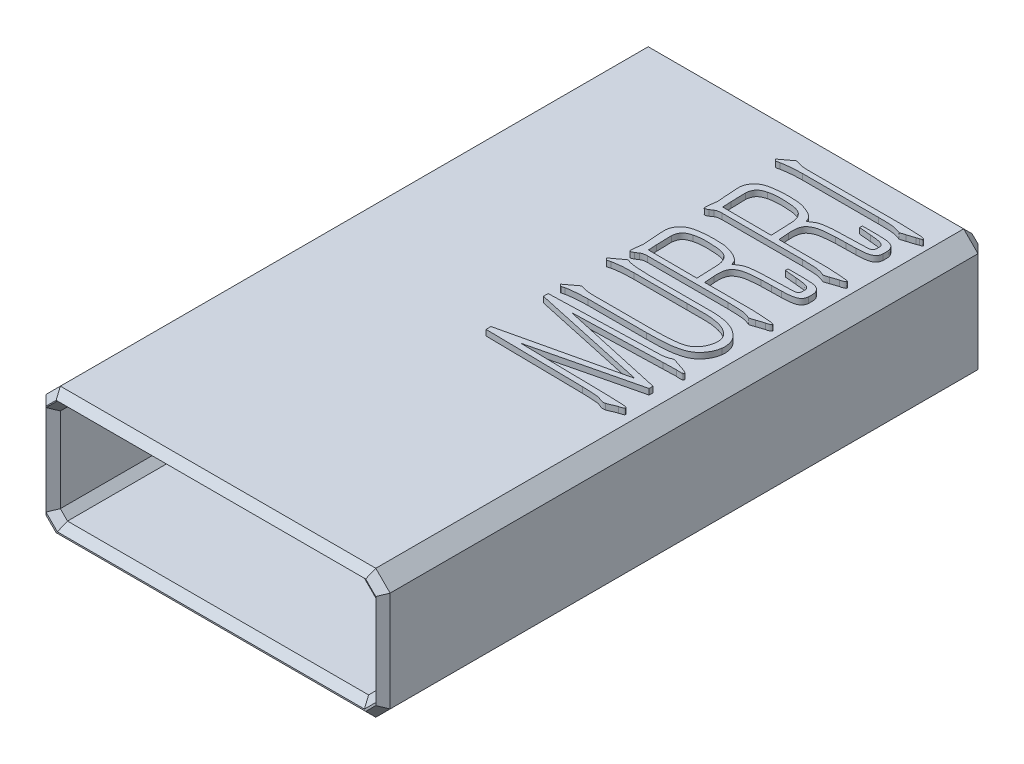
from build123d import *

# Parameters (mm, degrees)
SKETCH1_W           = 12
SKETCH1_H           = 4.5
SKETCH1_W_2         = 11
SKETCH1_H_2         = 3.45
BOSS_EXTRUDE1_DEPTH = 21.25
SKETCH2_W           = 12
SKETCH2_H           = 4.5
BOSS_EXTRUDE2_DEPTH = 1
CHAMFER1_SIZE       = 0.25
CHAMFER2_SIZE       = 0.5
CHAMFER3_SIZE       = 0.5
CHAMFER4_SIZE       = 0.25
CHAMFER5_SIZE       = 0.25
BOSS_EXTRUDE3_DEPTH = 0.2


with BuildPart() as part:
    # Sketch1 → Boss-Extrude1 (new body)
    with BuildSketch(Plane.XY):
        with Locations((6, 2.25)):
            Rectangle(SKETCH1_W, SKETCH1_H)
        with Locations((6, 2.275)):
            Rectangle(SKETCH1_W_2, SKETCH1_H_2, mode=Mode.SUBTRACT)
    extrude(amount=BOSS_EXTRUDE1_DEPTH)

    # Sketch2 → Boss-Extrude2 (add)
    with BuildSketch(Plane.XY):
        with Locations((6, 2.25)):
            Rectangle(SKETCH2_W, SKETCH2_H)
    extrude(amount=BOSS_EXTRUDE2_DEPTH)

    # Chamfer1
    chamfer1_edges = [part.edges().sort_by_distance(p)[0] for p in [
        (0.5, 4, 11.125),
        (0.5, 0.55, 11.125),
        (11.5, 0.55, 11.125),
        (11.5, 4, 11.125),
    ]]
    chamfer(chamfer1_edges, length=CHAMFER1_SIZE)

    # Chamfer2
    chamfer2_edges = [part.edges().sort_by_distance(p)[0] for p in [
        (0, 4.5, 10.625),
        (12, 4.5, 10.625),
        (12, 0, 10.625),
        (0, 0, 10.625),
    ]]
    chamfer(chamfer2_edges, length=CHAMFER2_SIZE)

    # Chamfer3
    chamfer3_edges = [part.edges().sort_by_distance(p)[0] for p in [
        (12, 2.25, 0),
        (0, 2.25, 0),
        (6, 4.5, 0),
        (6, 0, 0),
        (0.25, 4.25, 0),
        (0.25, 0.25, 0),
        (11.75, 4.25, 0),
        (11.75, 0.25, 0),
    ]]
    chamfer(chamfer3_edges, length=CHAMFER3_SIZE)

    # Chamfer4
    chamfer4_edges = [part.edges().sort_by_distance(p)[0] for p in [
        (12, 2.25, 21.25),
        (6, 0, 21.25),
        (0, 2.25, 21.25),
        (6, 4.5, 21.25),
        (0.25, 4.25, 21.25),
        (0.25, 0.25, 21.25),
        (11.75, 4.25, 21.25),
        (11.75, 0.25, 21.25),
    ]]
    chamfer(chamfer4_edges, length=CHAMFER4_SIZE)

    # Chamfer5
    chamfer5_edges = [part.edges().sort_by_distance(p)[0] for p in [
        (6, 0.55, 21.25),
        (11.5, 2.275, 21.25),
        (6, 4, 21.25),
        (0.5, 2.275, 21.25),
        (11.375, 0.675, 21.25),
        (11.375, 3.875, 21.25),
        (0.625, 0.675, 21.25),
        (0.625, 3.875, 21.25),
    ]]
    chamfer(chamfer5_edges, length=CHAMFER5_SIZE - 0.0001)  # a hair under: the kernel refuses the full size

    # Sketch3 → Boss-Extrude3 (add)
    # profile 1 of 5: a face of its own
    with BuildSketch(Plane(origin=(0, 4.5, 0), x_dir=(1, 0, 0), z_dir=(0, 1, 0))):
        with BuildLine():
            Line((6.408374174, -10.063404118), (6.408374174, -9.898264548))
            Line((6.408374174, -9.898264548), (9.78148306, -9.79811539))
            Line((9.78148306, -9.79811539), (10.097911784, -9.790657474))
            add(Edge.make_bspline(
                [(10.097911784, -9.790657474), (10.133074665, -9.790299434), (10.192804257, -9.789691246), (10.272977707, -9.784779271), (10.33947594, -9.773977392), (10.402801642, -9.759287431), (10.463109407, -9.741710792), (10.514814565, -9.721231324), (10.552809134, -9.702736276), (10.582656795, -9.691760941), (10.61143664, -9.696895999), (10.648360747, -9.704872606), (10.701254758, -9.72488823), (10.742458237, -9.738960021), (10.765927978, -9.746975394)],
                knots=[0, 0, 0, 0, 1.833619664, 3.114686552, 4.183267866, 5.342211314, 6.502189863, 7.458137416, 8.229013798, 8.72761631, 9.062984896, 9.7278169, 10.705751284, 12, 12, 12, 12], degree=3))
            Line((10.765927978, -9.746975394), (11.010973791, -9.826881638))
            add(Edge.make_bspline(
                [(11.010973791, -9.826881638), (11.033378665, -9.835692324), (11.072972529, -9.851262556), (11.123574784, -9.872127151), (11.157962578, -9.88753908), (11.179775082, -9.901761515), (11.192919786, -9.916215805), (11.196470791, -9.93422715), (11.186013789, -9.949130752), (11.175137677, -9.95330761), (11.168655444, -9.955797044)],
                knots=[0, 0, 0, 0, 2.256952659, 3.988483765, 5.135235217, 5.781778538, 6.421425199, 6.92532559, 7.359487195, 8, 8, 8, 8], degree=3))
            add(Edge.make_bspline(
                [(11.168655444, -9.955797044), (11.159938474, -9.960289551), (11.137756512, -9.971721577), (11.090940907, -9.971811455), (11.028339065, -9.971719626), (10.980449442, -9.966307319), (10.953441296, -9.96325496)],
                knots=[0, 0, 0, 0, 0.533370556, 1.357261302, 2.50958371, 4, 4, 4, 4], degree=3))
            Line((10.953441296, -9.96325496), (10.50063925, -9.977105375))
            Line((10.50063925, -9.977105375), (7.386426593, -10.063404118))
            Line((7.386426593, -10.063404118), (11.039740038, -10.868859051))
            Line((11.039740038, -10.868859051), (11.032282122, -11.006297789))
            Line((11.032282122, -11.006297789), (7.429043256, -11.875677717))
            Line((7.429043256, -11.875677717), (10.535797997, -11.933210212))
            Line((10.535797997, -11.933210212), (10.982207543, -11.948126044))
            add(Edge.make_bspline(
                [(10.982207543, -11.948126044), (11.014615534, -11.948300784), (11.072596653, -11.94861341), (11.139150645, -11.958944289), (11.180471279, -11.969138633), (11.199097458, -11.976975429), (11.212895663, -11.986061596), (11.212512042, -11.994405023), (11.212337524, -11.998200623)],
                knots=[0, 0, 0, 0, 2.35867652, 4.21990684, 4.917432392, 5.427710553, 5.739653463, 6, 6, 6, 6], degree=3))
            add(Edge.make_bspline(
                [(11.212337524, -11.998200623), (11.2119862, -12.003251133), (11.211234306, -12.014060109), (11.200234689, -12.03288735), (11.167622475, -12.048722113), (11.13010383, -12.060202716), (11.094613311, -12.072386801), (11.07198274, -12.07811701), (11.057340596, -12.083300012), (11.04969668, -12.084203895), (11.047197954, -12.084499366)],
                knots=[0, 0, 0, 0, 0.609790462, 1.30505856, 2.525401483, 4.85740158, 6.125560505, 7.067287064, 7.695104769, 8, 8, 8, 8], degree=3))
            Line((11.047197954, -12.084499366), (10.723311315, -12.214480189))
            add(Edge.make_bspline(
                [(10.723311315, -12.214480189), (10.707061903, -12.217988168), (10.675147538, -12.224877951), (10.62454796, -12.223606244), (10.571116097, -12.209933126), (10.515702861, -12.190024818), (10.465110492, -12.16849508), (10.427473298, -12.154527663), (10.398712181, -12.146015214), (10.369954157, -12.14287589), (10.3320716, -12.137944772), (10.287895675, -12.135775409), (10.243834038, -12.132960821), (10.20626375, -12.129192146), (10.177761409, -12.127722389), (10.157949119, -12.125160143), (10.140906449, -12.12359422), (10.120646868, -12.122670096), (10.091498544, -12.121914404), (10.053558865, -12.118998315), (10.006616174, -12.119006516), (9.951267769, -12.115817746), (9.886942602, -12.115723549), (9.841142655, -12.11412224), (9.816641807, -12.113265614)],
                knots=[0, 0, 0, 0, 1.187969647, 2.333210464, 3.586158238, 5.12312342, 6.550003327, 7.523861941, 7.999186015, 8.693658805, 9.589978601, 10.737478277, 11.859592069, 12.753380394, 13.442237408, 13.903039052, 14.184071854, 14.668167729, 15.355613632, 16.272992588, 17.392796313, 18.716837295, 20.243660171, 22, 22, 22, 22], degree=3))
            Line((9.816641807, -12.113265614), (6.408374174, -12.063191035))
            Line((6.408374174, -12.063191035), (6.408374174, -11.890593549))
            Line((6.408374174, -11.890593549), (10.478265502, -10.948765294))
            Line((10.478265502, -10.948765294), (6.408374174, -10.063404118))
        make_face()
    # profile 2 of 5: a face of its own
    with BuildSketch(Plane(origin=(0, 4.5, 0), x_dir=(1, 0, 0), z_dir=(0, 1, 0))):
        with BuildLine():
            add(Edge.make_bspline(
                [(6.761027062, -9.084286283), (6.78524265, -9.090428969), (6.829507949, -9.101657596), (6.894259681, -9.122051655), (6.96504597, -9.135778033), (7.033808884, -9.148556549), (7.104301703, -9.156673924), (7.174002455, -9.16057444), (7.257502062, -9.162304204), (7.317884155, -9.162840219), (7.350202429, -9.16312711)],
                knots=[0, 0, 0, 0, 1.003716487, 1.834760708, 2.724721785, 3.897654695, 4.644570232, 5.573815479, 6.701434605, 8, 8, 8, 8], degree=3))
            Line((7.350202429, -9.16312711), (9.313765182, -9.16312711))
            add(Edge.make_bspline(
                [(9.313765182, -9.16312711), (9.389415412, -9.162829469), (9.53365461, -9.162261971), (9.739748528, -9.155017912), (9.925193473, -9.14206118), (10.090358091, -9.126196551), (10.235139128, -9.103013848), (10.358267597, -9.068931465), (10.46191891, -9.028281231), (10.542824647, -8.972646814), (10.60777678, -8.911071292), (10.663803981, -8.845866663), (10.710687178, -8.775218878), (10.749045276, -8.700771446), (10.777923794, -8.624619818), (10.801047093, -8.550510436), (10.814399414, -8.478191415), (10.816191655, -8.430879815), (10.817067974, -8.407746756)],
                knots=[0, 0, 0, 0, 1.905203819, 3.632574198, 5.192565944, 6.586287381, 7.811156405, 8.878821117, 9.800770685, 10.599565557, 11.333646137, 12.050580277, 12.760055205, 13.464096933, 14.15506361, 14.808726733, 15.417525614, 16, 16, 16, 16], degree=3))
            add(Edge.make_bspline(
                [(10.817067974, -8.407746756), (10.816698932, -8.373506349), (10.815985385, -8.307302151), (10.791838218, -8.212769672), (10.74985983, -8.128179719), (10.688427226, -8.0580151), (10.619890121, -7.996713544), (10.545955517, -7.945861164), (10.469624575, -7.903033841), (10.363432363, -7.862120452), (10.228542319, -7.824900399), (10.068187184, -7.795968993), (9.915424707, -7.778689192), (9.803533459, -7.774654947), (9.726436853, -7.774929845), (9.675296424, -7.774874293), (9.612437004, -7.774894557), (9.53750265, -7.774887522), (9.450138509, -7.7748899), (9.350699622, -7.774889123), (9.239186022, -7.774889364), (9.161055473, -7.774889328), (9.119859365, -7.774889309)],
                knots=[0, 0, 0, 0, 1.015663207, 1.963795819, 2.875740241, 3.798333249, 4.718745757, 5.606813955, 6.462685027, 7.316139764, 8.985121632, 10.618098866, 12.159395575, 13.555042318, 13.945965981, 14.453110192, 15.076474951, 15.816060259, 16.682431619, 17.675589033, 18.77440149, 20, 20, 20, 20], degree=3))
            Line((9.119859365, -7.774889309), (7.271361602, -7.774889309))
            add(Edge.make_bspline(
                [(7.271361602, -7.774889309), (7.215954216, -7.775309884), (7.113988779, -7.776083863), (6.970076488, -7.781333451), (6.839517585, -7.79064076), (6.7363933, -7.804543375), (6.659091475, -7.815982623), (6.609863472, -7.822964999), (6.570508487, -7.831372869), (6.547219061, -7.837336933), (6.53728958, -7.83987972)],
                knots=[0, 0, 0, 0, 1.800454758, 3.313351646, 4.679077347, 6.051806317, 6.693209159, 7.218773997, 7.666923167, 8, 8, 8, 8], degree=3))
            Line((6.53728958, -7.83987972), (6.42222459, -7.868645968))
            Line((6.42222459, -7.868645968), (6.350841679, -7.803655556))
            Line((6.350841679, -7.803655556), (6.782335393, -7.487226833))
            add(Edge.make_bspline(
                [(6.782335393, -7.487226833), (6.806421777, -7.495908305), (6.850056067, -7.511635442), (6.916435264, -7.53288961), (6.99095733, -7.546403345), (7.081963986, -7.561639679), (7.190524268, -7.572064776), (7.267787942, -7.573028942), (7.307585766, -7.573525576)],
                knots=[0, 0, 0, 0, 0.860918451, 1.559618272, 2.339304497, 3.403130484, 4.662375828, 6, 6, 6, 6], degree=3))
            Line((7.307585766, -7.573525576), (7.645322821, -7.588441408))
            Line((7.645322821, -7.588441408), (9.356381845, -7.588441408))
            add(Edge.make_bspline(
                [(9.356381845, -7.588441408), (9.400774233, -7.588445696), (9.485297339, -7.588453861), (9.604623614, -7.588399544), (9.710101043, -7.588568887), (9.833723441, -7.587871539), (9.98470675, -7.592962025), (10.167374509, -7.612177821), (10.352151321, -7.643568084), (10.501232063, -7.690697191), (10.615763176, -7.738662344), (10.699427536, -7.783217881), (10.778930952, -7.839032418), (10.857639972, -7.898542263), (10.926485533, -7.967592874), (10.987523789, -8.039625309), (11.030333345, -8.119853697), (11.062687328, -8.201422273), (11.082102597, -8.283477822), (11.094004608, -8.362206626), (11.098405161, -8.437397549), (11.092624538, -8.485553208), (11.089814618, -8.508961331)],
                knots=[0, 0, 0, 0, 1.18432064, 2.254946499, 3.18345388, 3.998266481, 5.553134704, 7.210506707, 8.896047553, 10.544186214, 11.367765206, 12.207106871, 13.066424334, 13.957235019, 14.834898921, 15.663530758, 16.465070008, 17.248026882, 17.999450096, 18.708271688, 19.372100047, 20, 20, 20, 20], degree=3))
            add(Edge.make_bspline(
                [(11.089814618, -8.508961331), (11.084487198, -8.545066176), (11.073691482, -8.618230612), (11.03696347, -8.7261244), (10.983996684, -8.833301537), (10.915742586, -8.938004499), (10.834127098, -9.036300623), (10.736592584, -9.118736928), (10.627960648, -9.187329724), (10.506122246, -9.237171099), (10.375831952, -9.275933853), (10.237594491, -9.306614204), (10.091434808, -9.330406106), (9.884809334, -9.348698855), (9.61970186, -9.361135412), (9.406115711, -9.363369066), (9.29884935, -9.364490843)],
                knots=[0, 0, 0, 0, 0.695552955, 1.409498913, 2.164499868, 2.973121369, 3.790871823, 4.593903182, 5.400959929, 6.23333487, 7.097677464, 7.994104003, 8.934841278, 9.922489009, 11.952209119, 14, 14, 14, 14], degree=3))
            Line((9.29884935, -9.364490843), (7.25644577, -9.364490843))
            add(Edge.make_bspline(
                [(7.25644577, -9.364490843), (7.202093112, -9.364621659), (7.098992991, -9.364869801), (6.951926298, -9.374162049), (6.818088011, -9.386308916), (6.714667907, -9.397100041), (6.639968389, -9.408113002), (6.593523449, -9.413470091), (6.555561296, -9.421183967), (6.53336353, -9.426917747), (6.523439165, -9.429481254)],
                knots=[0, 0, 0, 0, 1.769193403, 3.355936188, 4.795300052, 6.144931018, 6.740140329, 7.253592783, 7.666289955, 8, 8, 8, 8], degree=3))
            Line((6.523439165, -9.429481254), (6.408374174, -9.458247502))
            Line((6.408374174, -9.458247502), (6.335925847, -9.400715007))
            Line((6.335925847, -9.400715007), (6.761027062, -9.084286283))
        make_face()
    # profile 3 of 5: a face of its own
    with BuildSketch(Plane(origin=(0, 4.5, 0), x_dir=(1, 0, 0), z_dir=(0, 1, 0))):
        with BuildLine():
            add(Edge.make_bspline(
                [(8.730982314, -5.812391972), (8.7618576, -5.791057438), (8.81785257, -5.752365435), (8.898588868, -5.697162216), (8.984798071, -5.653470741), (9.090282458, -5.625938304), (9.217618293, -5.604312682), (9.365693859, -5.588451328), (9.52948088, -5.57588994), (9.643306801, -5.575171739), (9.701576817, -5.574804075)],
                knots=[0, 0, 0, 0, 0.881232765, 1.598190978, 2.295533752, 3.137383339, 4.144986829, 5.328248715, 6.632271209, 8, 8, 8, 8], degree=3))
            Line((9.701576817, -5.574804075), (10.370658427, -5.553495744))
            add(Edge.make_bspline(
                [(10.370658427, -5.553495744), (10.407915068, -5.552813163), (10.479612753, -5.551499585), (10.581177182, -5.54921458), (10.664906214, -5.53813839), (10.726112515, -5.524165825), (10.757534431, -5.492920279), (10.771888454, -5.4571172), (10.779095059, -5.408908757), (10.780219422, -5.372404034), (10.78084381, -5.352132011)],
                knots=[0, 0, 0, 0, 1.650878855, 3.176995805, 4.477566197, 5.427151683, 5.849543733, 6.384248205, 7.102730973, 8, 8, 8, 8], degree=3))
            add(Edge.make_bspline(
                [(10.78084381, -5.352132011), (10.781816944, -5.331785023), (10.783637579, -5.293717905), (10.765466941, -5.238318213), (10.724488862, -5.192751072), (10.661378053, -5.162415594), (10.584168205, -5.13803349), (10.490516191, -5.125199209), (10.380055664, -5.112145033), (10.299660186, -5.104748126), (10.255593437, -5.100693698)],
                knots=[0, 0, 0, 0, 0.741989737, 1.388186353, 2.079962278, 2.924457633, 3.920621767, 5.041832983, 6.378555544, 8, 8, 8, 8], degree=3))
            Line((10.255593437, -5.100693698), (9.845408055, -5.064469535))
            Line((9.845408055, -5.064469535), (9.845408055, -4.970712876))
            Line((9.845408055, -4.970712876), (10.349350096, -4.970712876))
            add(Edge.make_bspline(
                [(10.349350096, -4.970712876), (10.396946775, -4.97112381), (10.484715751, -4.971881578), (10.604816112, -4.977101911), (10.70243695, -4.984578963), (10.779503383, -4.997222334), (10.842190286, -5.014525245), (10.894060989, -5.039107609), (10.939628867, -5.069089876), (10.975083987, -5.106890678), (11.004653118, -5.147556558), (11.025762926, -5.19212661), (11.041633224, -5.238890296), (11.047659997, -5.302304416), (11.052124954, -5.373785791), (11.048715567, -5.428840301), (11.047197954, -5.453346586)],
                knots=[0, 0, 0, 0, 1.955797874, 3.606520016, 4.939685233, 5.976159067, 6.81209678, 7.602055893, 8.326624086, 9.038739689, 9.719039995, 10.384783355, 11.058635172, 11.735640267, 12.992070879, 14, 14, 14, 14], degree=3))
            add(Edge.make_bspline(
                [(11.047197954, -5.453346586), (11.045751456, -5.470522022), (11.042990261, -5.503307921), (11.028184455, -5.548668172), (11.009257764, -5.589021829), (10.983105364, -5.624135604), (10.948796215, -5.653586222), (10.906224766, -5.677881341), (10.855713043, -5.699027038), (10.795468811, -5.717392641), (10.722109366, -5.732624779), (10.632530558, -5.741827524), (10.52564726, -5.75086823), (10.448457402, -5.7534623), (10.406882591, -5.754859477)],
                knots=[0, 0, 0, 0, 0.785514098, 1.499454538, 2.167605402, 2.81714562, 3.484704239, 4.219933844, 5.049370252, 5.984178009, 7.095655963, 8.469322192, 10.098360771, 12, 12, 12, 12], degree=3))
            Line((10.406882591, -5.754859477), (10.06168762, -5.762317393))
            Line((10.06168762, -5.762317393), (9.709034733, -5.769775309))
            add(Edge.make_bspline(
                [(9.709034733, -5.769775309), (9.662852403, -5.772424551), (9.564373736, -5.778073763), (9.415872996, -5.790563993), (9.271984948, -5.804587323), (9.145841008, -5.829605231), (9.038993429, -5.866772937), (8.947981016, -5.915835886), (8.87265888, -5.976365036), (8.820517733, -6.052206342), (8.791406179, -6.140830591), (8.775495159, -6.241825948), (8.769552922, -6.357150038), (8.772897958, -6.438509522), (8.774664394, -6.481473583)],
                knots=[0, 0, 0, 0, 1.186979477, 2.53110138, 3.824333442, 4.894950986, 5.823084238, 6.716241149, 7.537709362, 8.27836356, 9.042203288, 9.911181308, 10.896943164, 12, 12, 12, 12], degree=3))
            Line((8.774664394, -6.481473583), (8.803430641, -6.83412647))
            Line((8.803430641, -6.83412647), (10.50063925, -6.83412647))
            add(Edge.make_bspline(
                [(10.50063925, -6.83412647), (10.556401316, -6.837247746), (10.657993401, -6.842934351), (10.794683754, -6.851594558), (10.900526407, -6.858171041), (10.997140292, -6.86333025), (11.089638982, -6.870006803), (11.167798198, -6.879684902), (11.218840854, -6.89097385), (11.240561893, -6.895787126), (11.257981194, -6.903046704), (11.25576653, -6.910304957), (11.254954187, -6.912967297)],
                knots=[0, 0, 0, 0, 2.178808862, 3.96953971, 5.343703216, 6.315136572, 7.746501362, 8.949576488, 9.416965186, 9.732908192, 9.902030233, 10, 10, 10, 10], degree=3))
            add(Edge.make_bspline(
                [(11.254954187, -6.912967297), (11.254444306, -6.916236076), (11.253136816, -6.92461823), (11.242001427, -6.939332218), (11.215884354, -6.957241237), (11.17502501, -6.975713531), (11.128655289, -6.993888964), (11.096325566, -6.997643709), (11.082356701, -6.99926604)],
                knots=[0, 0, 0, 0, 0.292342883, 0.749657129, 1.586799747, 3.104202277, 4.748798175, 6, 6, 6, 6], degree=3))
            Line((11.082356701, -6.99926604), (10.823460473, -7.085564783))
            add(Edge.make_bspline(
                [(10.823460473, -7.085564783), (10.800014109, -7.093658289), (10.758851673, -7.107867249), (10.705652272, -7.127155004), (10.669125668, -7.136747264), (10.640008307, -7.142041111), (10.610822348, -7.129143793), (10.571409679, -7.11259081), (10.517920083, -7.091388349), (10.453415528, -7.074501794), (10.387411812, -7.05906766), (10.331482588, -7.049410305), (10.27974335, -7.045729699), (10.221938489, -7.040845871), (10.143368695, -7.038501074), (10.05174126, -7.035640595), (9.962618215, -7.03217323), (9.891189314, -7.031131167), (9.845430349, -7.027794095), (9.823390802, -7.027976447), (9.816641807, -7.028032288)],
                knots=[0, 0, 0, 0, 1.301983991, 2.285763148, 2.958964452, 3.29633742, 3.803082126, 4.571146853, 5.567543572, 6.806010732, 8.066831942, 9.123403438, 9.777784829, 10.786469319, 12.16609629, 13.899429871, 15.595526634, 16.844179072, 17.646062189, 18, 18, 18, 18], degree=3))
            Line((9.816641807, -7.028032288), (7.005007458, -7.028032288))
            add(Edge.make_bspline(
                [(7.005007458, -7.028032288), (6.983283634, -7.028523079), (6.941736208, -7.029461731), (6.882676521, -7.039926147), (6.8286521, -7.053100777), (6.797348761, -7.070001247), (6.782335393, -7.078106867)],
                knots=[0, 0, 0, 0, 1.127954724, 2.157245254, 3.116197974, 4, 4, 4, 4], degree=3))
            Line((6.782335393, -7.078106867), (6.674728319, -7.150555194))
            add(Edge.make_bspline(
                [(6.674728319, -7.150555194), (6.661723894, -7.157832204), (6.638325859, -7.170925266), (6.605282905, -7.186167234), (6.5783292, -7.191085888), (6.55546861, -7.19303058), (6.538612748, -7.176608033), (6.536893738, -7.148645832), (6.536134467, -7.110635141), (6.541582727, -7.081297826), (6.544747496, -7.064256451)],
                knots=[0, 0, 0, 0, 1.376189476, 2.476090326, 3.310291879, 3.9328338, 4.465478062, 5.267620607, 6.412823299, 8, 8, 8, 8], degree=3))
            Line((6.544747496, -7.064256451), (6.559663328, -6.912967297))
            Line((6.559663328, -6.912967297), (6.58097166, -6.761678143))
            Line((6.58097166, -6.761678143), (6.559663328, -6.481473583))
            add(Edge.make_bspline(
                [(6.559663328, -6.481473583), (6.555886805, -6.426085795), (6.548965075, -6.324569329), (6.542603239, -6.185575226), (6.534695275, -6.07452349), (6.528769445, -5.986476868), (6.530512418, -5.912529799), (6.540861616, -5.843464062), (6.562637173, -5.77613921), (6.593809889, -5.71119035), (6.632658481, -5.649565837), (6.680034751, -5.594463716), (6.732626412, -5.544289309), (6.793731856, -5.501261603), (6.864364006, -5.462660611), (6.948242851, -5.433434274), (7.043629, -5.405799198), (7.152008912, -5.387153338), (7.271053035, -5.371150377), (7.39972176, -5.359438905), (7.53765387, -5.353325048), (7.632531975, -5.352538401), (7.681546985, -5.352132011)],
                knots=[0, 0, 0, 0, 1.679844652, 3.078871672, 4.209725109, 5.049028505, 5.747860701, 6.443960972, 7.15426632, 7.880090953, 8.619393692, 9.351397016, 10.073632976, 10.81316998, 11.606497123, 12.500757424, 13.49418339, 14.609147992, 15.823466198, 17.129115867, 18.516871591, 20, 20, 20, 20], degree=3))
            add(Edge.make_bspline(
                [(7.681546985, -5.352132011), (7.728431669, -5.352517923), (7.81621372, -5.353240466), (7.938219947, -5.35899021), (8.041144721, -5.370163598), (8.150507596, -5.391357556), (8.268042428, -5.425428702), (8.393309645, -5.4757702), (8.502662643, -5.529431417), (8.579609019, -5.58043245), (8.628277285, -5.621986548), (8.657164348, -5.649295486), (8.676760133, -5.67708019), (8.684736429, -5.696121215), (8.688365651, -5.704784898)],
                knots=[0, 0, 0, 0, 1.521520026, 2.848737329, 3.962410036, 4.87785905, 6.46098997, 7.92489015, 9.254707097, 10.408681267, 10.907477065, 11.331258808, 11.695722187, 12, 12, 12, 12], degree=3))
            Line((8.688365651, -5.704784898), (8.730982314, -5.812391972))
        make_face()
        with BuildLine():
            Line((8.537076497, -6.84051897), (8.508310249, -6.128820696))
            add(Edge.make_bspline(
                [(8.508310249, -6.128820696), (8.506650336, -6.100364134), (8.503503849, -6.046422645), (8.491818747, -5.970464851), (8.47530652, -5.903810172), (8.445929453, -5.82992003), (8.398689027, -5.752191381), (8.335157852, -5.691246953), (8.276430684, -5.653826533), (8.223996729, -5.630880258), (8.16448835, -5.609077136), (8.093958733, -5.592507497), (8.010226495, -5.57677192), (7.908277158, -5.567356054), (7.786782343, -5.559651435), (7.651381556, -5.557435236), (7.513769047, -5.557033654), (7.385749146, -5.565882611), (7.272262397, -5.579491753), (7.202712914, -5.595891362), (7.170147027, -5.603570323)],
                knots=[0, 0, 0, 0, 0.918172889, 1.740463719, 2.473302386, 3.12576875, 4.297696032, 5.374318763, 5.929962264, 6.534276509, 7.214846156, 7.969870388, 8.86558466, 9.958868387, 11.266057701, 12.788632169, 14.32230717, 15.698757848, 16.92246516, 18, 18, 18, 18], degree=3))
            add(Edge.make_bspline(
                [(7.170147027, -5.603570323), (7.139992523, -5.61192929), (7.083443496, -5.62760494), (7.008573857, -5.662689787), (6.94576626, -5.699585707), (6.899451872, -5.746796666), (6.86406291, -5.799632474), (6.838989241, -5.861060397), (6.819205116, -5.930301427), (6.813881208, -5.980230331), (6.811101641, -6.006297789)],
                knots=[0, 0, 0, 0, 1.275631098, 2.392203014, 3.370219373, 4.231894316, 5.068789048, 5.952648395, 6.93109503, 8, 8, 8, 8], degree=3))
            add(Edge.make_bspline(
                [(6.811101641, -6.006297789), (6.811046509, -6.014821934), (6.810910945, -6.035782196), (6.812434746, -6.072703212), (6.813357507, -6.121360025), (6.81411923, -6.181394043), (6.816742711, -6.252755658), (6.81841237, -6.335526311), (6.822042842, -6.429614369), (6.823948563, -6.496387518), (6.824952056, -6.531548162)],
                knots=[0, 0, 0, 0, 0.389305479, 0.957274318, 1.687402304, 2.612145096, 3.699440328, 4.948883328, 6.393377747, 8, 8, 8, 8], degree=3))
            Line((6.824952056, -6.531548162), (6.839867888, -6.83412647))
            Line((6.839867888, -6.83412647), (8.537076497, -6.84051897))
        make_face(mode=Mode.SUBTRACT)
    # profile 4 of 5: a face of its own
    with BuildSketch(Plane(origin=(0, 4.5, 0), x_dir=(1, 0, 0), z_dir=(0, 1, 0))):
        with BuildLine():
            add(Edge.make_bspline(
                [(8.730982314, -3.221298855), (8.7618576, -3.199964321), (8.81785257, -3.161272318), (8.898588868, -3.106069099), (8.984798071, -3.062377624), (9.090282458, -3.034845187), (9.217618293, -3.013219565), (9.365693859, -2.99735821), (9.52948088, -2.984796823), (9.643306801, -2.984078621), (9.701576817, -2.983710958)],
                knots=[0, 0, 0, 0, 0.881232765, 1.598190978, 2.295533752, 3.137383339, 4.144986829, 5.328248715, 6.632271209, 8, 8, 8, 8], degree=3))
            Line((9.701576817, -2.983710958), (10.370658427, -2.962402626))
            add(Edge.make_bspline(
                [(10.370658427, -2.962402626), (10.407915068, -2.961720045), (10.479612753, -2.960406468), (10.581177182, -2.958121463), (10.664906214, -2.947045273), (10.726112515, -2.933072708), (10.757534431, -2.901827162), (10.771888454, -2.866024083), (10.779095059, -2.81781564), (10.780219422, -2.781310916), (10.78084381, -2.761038893)],
                knots=[0, 0, 0, 0, 1.650878855, 3.176995805, 4.477566197, 5.427151683, 5.849543733, 6.384248205, 7.102730973, 8, 8, 8, 8], degree=3))
            add(Edge.make_bspline(
                [(10.78084381, -2.761038893), (10.781816944, -2.740691906), (10.783637579, -2.702624788), (10.765466941, -2.647225096), (10.724488862, -2.601657955), (10.661378053, -2.571322477), (10.584168205, -2.546940373), (10.490516191, -2.534106092), (10.380055664, -2.521051915), (10.299660186, -2.513655008), (10.255593437, -2.509600581)],
                knots=[0, 0, 0, 0, 0.741989737, 1.388186353, 2.079962278, 2.924457633, 3.920621767, 5.041832983, 6.378555544, 8, 8, 8, 8], degree=3))
            Line((10.255593437, -2.509600581), (9.845408055, -2.473376417))
            Line((9.845408055, -2.473376417), (9.845408055, -2.379619758))
            Line((9.845408055, -2.379619758), (10.349350096, -2.379619758))
            add(Edge.make_bspline(
                [(10.349350096, -2.379619758), (10.396946775, -2.380030692), (10.484715751, -2.380788461), (10.604816112, -2.386008794), (10.70243695, -2.393485846), (10.779503383, -2.406129217), (10.842190286, -2.423432127), (10.894060989, -2.448014491), (10.939628867, -2.477996759), (10.975083987, -2.515797561), (11.004653118, -2.556463441), (11.025762926, -2.601033492), (11.041633224, -2.647797179), (11.047659997, -2.711211298), (11.052124954, -2.782692674), (11.048715567, -2.837747184), (11.047197954, -2.862253468)],
                knots=[0, 0, 0, 0, 1.955797874, 3.606520016, 4.939685233, 5.976159067, 6.81209678, 7.602055893, 8.326624086, 9.038739689, 9.719039995, 10.384783355, 11.058635172, 11.735640267, 12.992070879, 14, 14, 14, 14], degree=3))
            add(Edge.make_bspline(
                [(11.047197954, -2.862253468), (11.045751456, -2.879428905), (11.042990261, -2.912214804), (11.028184455, -2.957575055), (11.009257764, -2.997928711), (10.983105364, -3.033042486), (10.948796215, -3.062493105), (10.906224766, -3.086788224), (10.855713043, -3.107933921), (10.795468811, -3.126299524), (10.722109366, -3.141531661), (10.632530558, -3.150734407), (10.52564726, -3.159775113), (10.448457402, -3.162369182), (10.406882591, -3.16376636)],
                knots=[0, 0, 0, 0, 0.785514098, 1.499454538, 2.167605402, 2.81714562, 3.484704239, 4.219933844, 5.049370252, 5.984178009, 7.095655963, 8.469322192, 10.098360771, 12, 12, 12, 12], degree=3))
            Line((10.406882591, -3.16376636), (10.06168762, -3.171224276))
            Line((10.06168762, -3.171224276), (9.709034733, -3.178682192))
            add(Edge.make_bspline(
                [(9.709034733, -3.178682192), (9.662852403, -3.181331433), (9.564373736, -3.186980645), (9.415872996, -3.199470875), (9.271984948, -3.213494205), (9.145841008, -3.238512114), (9.038993429, -3.27567982), (8.947981016, -3.324742769), (8.87265888, -3.385271919), (8.820517733, -3.461113225), (8.791406179, -3.549737474), (8.775495159, -3.65073283), (8.769552922, -3.766056921), (8.772897958, -3.847416404), (8.774664394, -3.890380466)],
                knots=[0, 0, 0, 0, 1.186979477, 2.53110138, 3.824333442, 4.894950986, 5.823084238, 6.716241149, 7.537709362, 8.27836356, 9.042203288, 9.911181308, 10.896943164, 12, 12, 12, 12], degree=3))
            Line((8.774664394, -3.890380466), (8.803430641, -4.243033353))
            Line((8.803430641, -4.243033353), (10.50063925, -4.243033353))
            add(Edge.make_bspline(
                [(10.50063925, -4.243033353), (10.556401316, -4.246154628), (10.657993401, -4.251841234), (10.794683754, -4.260501441), (10.900526407, -4.267077923), (10.997140292, -4.272237133), (11.089638982, -4.278913686), (11.167798198, -4.288591784), (11.218840854, -4.299880732), (11.240561893, -4.304694009), (11.257981194, -4.311953586), (11.25576653, -4.319211839), (11.254954187, -4.32187418)],
                knots=[0, 0, 0, 0, 2.178808862, 3.96953971, 5.343703216, 6.315136572, 7.746501362, 8.949576488, 9.416965186, 9.732908192, 9.902030233, 10, 10, 10, 10], degree=3))
            add(Edge.make_bspline(
                [(11.254954187, -4.32187418), (11.254444306, -4.325142958), (11.253136816, -4.333525112), (11.242001427, -4.3482391), (11.215884354, -4.366148119), (11.17502501, -4.384620413), (11.128655289, -4.402795846), (11.096325566, -4.406550591), (11.082356701, -4.408172923)],
                knots=[0, 0, 0, 0, 0.292342883, 0.749657129, 1.586799747, 3.104202277, 4.748798175, 6, 6, 6, 6], degree=3))
            Line((11.082356701, -4.408172923), (10.823460473, -4.494471665))
            add(Edge.make_bspline(
                [(10.823460473, -4.494471665), (10.800014109, -4.502565172), (10.758851673, -4.516774132), (10.705652272, -4.536061886), (10.669125668, -4.545654147), (10.640008307, -4.550947994), (10.610822348, -4.538050676), (10.571409679, -4.521497692), (10.517920083, -4.500295232), (10.453415528, -4.483408677), (10.387411812, -4.467974543), (10.331482588, -4.458317188), (10.27974335, -4.454636581), (10.221938489, -4.449752753), (10.143368695, -4.447407957), (10.05174126, -4.444547478), (9.962618215, -4.441080113), (9.891189314, -4.44003805), (9.845430349, -4.436700978), (9.823390802, -4.43688333), (9.816641807, -4.43693917)],
                knots=[0, 0, 0, 0, 1.301983991, 2.285763148, 2.958964452, 3.29633742, 3.803082126, 4.571146853, 5.567543572, 6.806010732, 8.066831942, 9.123403438, 9.777784829, 10.786469319, 12.16609629, 13.899429871, 15.595526634, 16.844179072, 17.646062189, 18, 18, 18, 18], degree=3))
            Line((9.816641807, -4.43693917), (7.005007458, -4.43693917))
            add(Edge.make_bspline(
                [(7.005007458, -4.43693917), (6.983283634, -4.437429962), (6.941736208, -4.438368614), (6.882676521, -4.448833029), (6.8286521, -4.46200766), (6.797348761, -4.478908129), (6.782335393, -4.487013749)],
                knots=[0, 0, 0, 0, 1.127954724, 2.157245254, 3.116197974, 4, 4, 4, 4], degree=3))
            Line((6.782335393, -4.487013749), (6.674728319, -4.559462077))
            add(Edge.make_bspline(
                [(6.674728319, -4.559462077), (6.661723894, -4.566739087), (6.638325859, -4.579832149), (6.605282905, -4.595074116), (6.5783292, -4.59999277), (6.55546861, -4.601937462), (6.538612748, -4.585514916), (6.536893738, -4.557552715), (6.536134467, -4.519542023), (6.541582727, -4.490204709), (6.544747496, -4.473163334)],
                knots=[0, 0, 0, 0, 1.376189476, 2.476090326, 3.310291879, 3.9328338, 4.465478062, 5.267620607, 6.412823299, 8, 8, 8, 8], degree=3))
            Line((6.544747496, -4.473163334), (6.559663328, -4.32187418))
            Line((6.559663328, -4.32187418), (6.58097166, -4.170585026))
            Line((6.58097166, -4.170585026), (6.559663328, -3.890380466))
            add(Edge.make_bspline(
                [(6.559663328, -3.890380466), (6.555886805, -3.834992677), (6.548965075, -3.733476211), (6.542603239, -3.594482109), (6.534695275, -3.483430373), (6.528769445, -3.39538375), (6.530512418, -3.321436682), (6.540861616, -3.252370944), (6.562637173, -3.185046092), (6.593809889, -3.120097233), (6.632658481, -3.058472719), (6.680034751, -3.003370599), (6.732626412, -2.953196192), (6.793731856, -2.910168486), (6.864364006, -2.871567494), (6.948242851, -2.842341157), (7.043629, -2.814706081), (7.152008912, -2.79606022), (7.271053035, -2.78005726), (7.39972176, -2.768345788), (7.53765387, -2.762231931), (7.632531975, -2.761445283), (7.681546985, -2.761038893)],
                knots=[0, 0, 0, 0, 1.679844652, 3.078871672, 4.209725109, 5.049028505, 5.747860701, 6.443960972, 7.15426632, 7.880090953, 8.619393692, 9.351397016, 10.073632976, 10.81316998, 11.606497123, 12.500757424, 13.49418339, 14.609147992, 15.823466198, 17.129115867, 18.516871591, 20, 20, 20, 20], degree=3))
            add(Edge.make_bspline(
                [(7.681546985, -2.761038893), (7.728431669, -2.761424806), (7.81621372, -2.762147349), (7.938219947, -2.767897093), (8.041144721, -2.77907048), (8.150507596, -2.800264439), (8.268042428, -2.834335585), (8.393309645, -2.884677083), (8.502662643, -2.938338299), (8.579609019, -2.989339332), (8.628277285, -3.03089343), (8.657164348, -3.058202369), (8.676760133, -3.085987072), (8.684736429, -3.105028098), (8.688365651, -3.113691781)],
                knots=[0, 0, 0, 0, 1.521520026, 2.848737329, 3.962410036, 4.87785905, 6.46098997, 7.92489015, 9.254707097, 10.408681267, 10.907477065, 11.331258808, 11.695722187, 12, 12, 12, 12], degree=3))
            Line((8.688365651, -3.113691781), (8.730982314, -3.221298855))
        make_face()
        with BuildLine():
            Line((8.537076497, -4.249425853), (8.508310249, -3.537727579))
            add(Edge.make_bspline(
                [(8.508310249, -3.537727579), (8.506650336, -3.509271017), (8.503503849, -3.455329527), (8.491818747, -3.379371734), (8.47530652, -3.312717055), (8.445929453, -3.238826913), (8.398689027, -3.161098264), (8.335157852, -3.100153836), (8.276430684, -3.062733415), (8.223996729, -3.03978714), (8.16448835, -3.017984019), (8.093958733, -3.001414379), (8.010226495, -2.985678802), (7.908277158, -2.976262937), (7.786782343, -2.968558317), (7.651381556, -2.966342118), (7.513769047, -2.965940537), (7.385749146, -2.974789494), (7.272262397, -2.988398636), (7.202712914, -3.004798244), (7.170147027, -3.012477206)],
                knots=[0, 0, 0, 0, 0.918172889, 1.740463719, 2.473302386, 3.12576875, 4.297696032, 5.374318763, 5.929962264, 6.534276509, 7.214846156, 7.969870388, 8.86558466, 9.958868387, 11.266057701, 12.788632169, 14.32230717, 15.698757848, 16.92246516, 18, 18, 18, 18], degree=3))
            add(Edge.make_bspline(
                [(7.170147027, -3.012477206), (7.139992523, -3.020836173), (7.083443496, -3.036511823), (7.008573857, -3.07159667), (6.94576626, -3.10849259), (6.899451872, -3.155703548), (6.86406291, -3.208539357), (6.838989241, -3.26996728), (6.819205116, -3.33920831), (6.813881208, -3.389137213), (6.811101641, -3.415204672)],
                knots=[0, 0, 0, 0, 1.275631098, 2.392203014, 3.370219373, 4.231894316, 5.068789048, 5.952648395, 6.93109503, 8, 8, 8, 8], degree=3))
            add(Edge.make_bspline(
                [(6.811101641, -3.415204672), (6.811046509, -3.423728817), (6.810910945, -3.444689078), (6.812434746, -3.481610094), (6.813357507, -3.530266908), (6.81411923, -3.590300926), (6.816742711, -3.661662541), (6.81841237, -3.744433193), (6.822042842, -3.838521252), (6.823948563, -3.905294401), (6.824952056, -3.940455045)],
                knots=[0, 0, 0, 0, 0.389305479, 0.957274318, 1.687402304, 2.612145096, 3.699440328, 4.948883328, 6.393377747, 8, 8, 8, 8], degree=3))
            Line((6.824952056, -3.940455045), (6.839867888, -4.243033353))
            Line((6.839867888, -4.243033353), (8.537076497, -4.249425853))
        make_face(mode=Mode.SUBTRACT)
    # profile 5 of 5: a face of its own
    with BuildSketch(Plane(origin=(0, 4.5, 0), x_dir=(1, 0, 0), z_dir=(0, 1, 0))):
        with BuildLine():
            Line((6.372150011, -1.932144796), (6.307159599, -1.8746123))
            Line((6.307159599, -1.8746123), (6.732260814, -1.558183577))
            add(Edge.make_bspline(
                [(6.732260814, -1.558183577), (6.756509978, -1.564600918), (6.800961508, -1.57636465), (6.864928408, -1.598587059), (6.932699122, -1.616724467), (6.998549271, -1.630068367), (7.066996247, -1.638184433), (7.137072093, -1.641909864), (7.223762684, -1.643699321), (7.286986629, -1.644206155), (7.321436182, -1.64448232)],
                knots=[0, 0, 0, 0, 1.004094297, 1.840621308, 2.709988942, 3.811664547, 4.527835238, 5.468168927, 6.62045227, 8, 8, 8, 8], degree=3))
            Line((7.321436182, -1.64448232), (10.471873002, -1.64448232))
            Line((10.471873002, -1.64448232), (11.068506286, -1.665790651))
            add(Edge.make_bspline(
                [(11.068506286, -1.665790651), (11.101683012, -1.666221803), (11.161989032, -1.667005517), (11.231279664, -1.679479517), (11.275862406, -1.691001158), (11.294682935, -1.698513326), (11.308945941, -1.70662368), (11.306908196, -1.713227297), (11.306094183, -1.71586523)],
                knots=[0, 0, 0, 0, 2.350613858, 4.272759335, 5.032422901, 5.55300769, 5.821440891, 6, 6, 6, 6], degree=3))
            add(Edge.make_bspline(
                [(11.306094183, -1.71586523), (11.305159622, -1.719107241), (11.30280431, -1.727277866), (11.292946809, -1.742116093), (11.265433575, -1.756121445), (11.241601608, -1.762730636), (11.226187939, -1.767005226)],
                knots=[0, 0, 0, 0, 0.404431204, 1.019261231, 2.072164124, 4, 4, 4, 4], degree=3))
            Line((11.226187939, -1.767005226), (11.133496697, -1.802163973))
            Line((11.133496697, -1.802163973), (10.874600469, -1.882070216))
            add(Edge.make_bspline(
                [(10.874600469, -1.882070216), (10.850109057, -1.890238256), (10.806875182, -1.904657026), (10.751314458, -1.923136102), (10.713525785, -1.933483278), (10.684166123, -1.938379875), (10.654630563, -1.927087663), (10.614656552, -1.912285014), (10.560515191, -1.893860639), (10.495732003, -1.877150488), (10.427506533, -1.8625161), (10.361926722, -1.853188577), (10.300789384, -1.846581818), (10.246043811, -1.8427188), (10.185308422, -1.839729302), (10.106429403, -1.839557969), (9.994572446, -1.837940845), (9.908624353, -1.838227209), (9.860323887, -1.838388137)],
                knots=[0, 0, 0, 0, 1.198884213, 2.116350494, 2.712041432, 3.026958238, 3.47079003, 4.138320862, 5.024452671, 6.11597897, 7.24422601, 8.260604491, 9.188963582, 10.097950463, 10.807507179, 12.010915499, 13.75824414, 16, 16, 16, 16], degree=3))
            Line((9.860323887, -1.838388137), (7.221287023, -1.838388137))
            add(Edge.make_bspline(
                [(7.221287023, -1.838388137), (7.16800113, -1.838561422), (7.065614273, -1.838894382), (6.919214863, -1.84788963), (6.786322499, -1.860498779), (6.670295872, -1.876302708), (6.574621876, -1.891583227), (6.518473389, -1.89986713), (6.494672917, -1.903378548)],
                knots=[0, 0, 0, 0, 1.312764434, 2.522427885, 3.612619408, 4.601480721, 5.407189385, 6, 6, 6, 6], degree=3))
            Line((6.494672917, -1.903378548), (6.372150011, -1.932144796))
        make_face()
    extrude(amount=BOSS_EXTRUDE3_DEPTH)


solid = part.part
